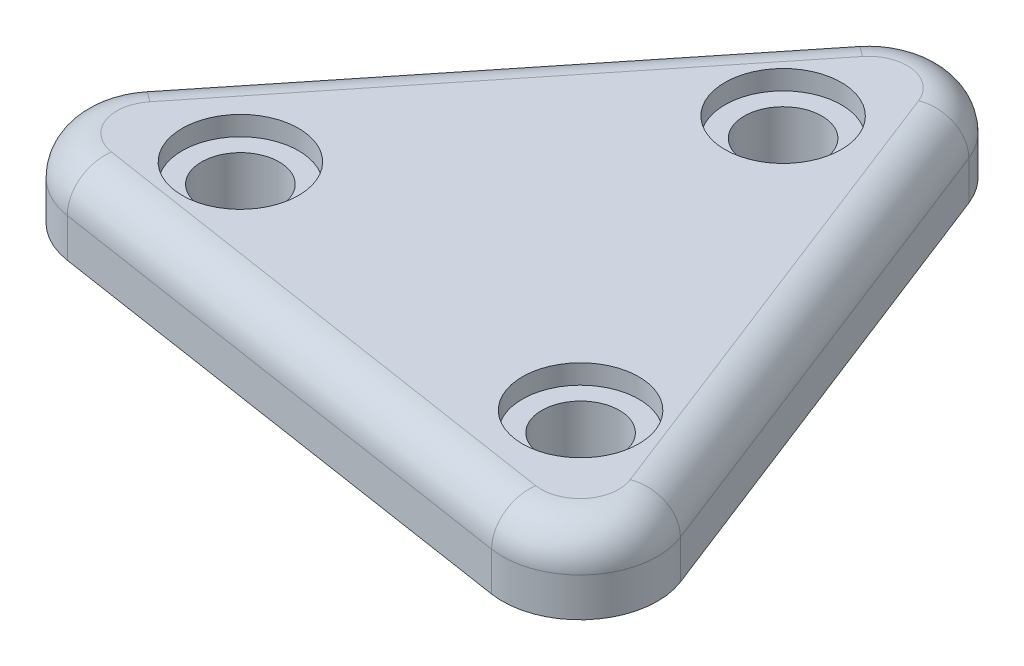
from build123d import *

# Parameters (mm, degrees)
SKETCH1_R           = 1
BOSS_EXTRUDE1_DEPTH = 2
FILLET1_R           = 2
FILLET2_R           = 1
SKETCH2_R           = 1.5
CUT_EXTRUDE1_DEPTH  = 0.5


with BuildPart() as part:
    # Sketch1 → Boss-Extrude1 (new body)
    with BuildSketch(Plane(origin=(0, 0, 0), x_dir=(1, 0, 0), z_dir=(0, 1, 0))):
        Polygon((1.750249519, 11.413586639), (-10.759580737, -4.191032773), (9.009331218, -7.222553866), align=None)
        with Locations((0.670392162, 5.734449205)):
            Circle(SKETCH1_R, mode=Mode.SUBTRACT)
        with Locations((4.630982607, -3.447801245)):
            Circle(SKETCH1_R, mode=Mode.SUBTRACT)
        with Locations((-5.301374769, -2.28664796)):
            Circle(SKETCH1_R, mode=Mode.SUBTRACT)
    extrude(amount=BOSS_EXTRUDE1_DEPTH)

    # Fillet1
    fillet1_edges = [part.edges().sort_by_distance(p)[0] for p in [
        (1.750249519, 1, -11.413586639),
        (9.009331218, 1, 7.222553866),
        (-10.759580737, 1, 4.191032773),
    ]]
    fillet(fillet1_edges, radius=FILLET1_R)

    # Fillet2
    fillet2_edges = [part.edges().sort_by_distance(p)[0] for p in [
        (-8.895966686, 2, 3.465124603),
        (-4.504665609, 2, -3.611276933),
        (1.44709741, 2, -9.436695443),
        (5.379790368, 2, -2.095516386),
        (7.448869277, 2, 5.97157084),
        (-0.875124759, 2, 5.706793319),
    ]]
    fillet(fillet2_edges, radius=FILLET2_R)

    # Sketch2 → Cut-Extrude1 (cut)
    with BuildSketch(Plane(origin=(0, 2, 0), x_dir=(1, 0, 0), z_dir=(0, 1, 0))):
        with Locations((0.670392162, 5.734449205)):
            Circle(SKETCH2_R)
        with Locations((-5.301374769, -2.28664796)):
            Circle(SKETCH2_R)
        with Locations((4.630982607, -3.447801245)):
            Circle(SKETCH2_R)
    extrude(amount=-CUT_EXTRUDE1_DEPTH, mode=Mode.SUBTRACT)


solid = part.part
